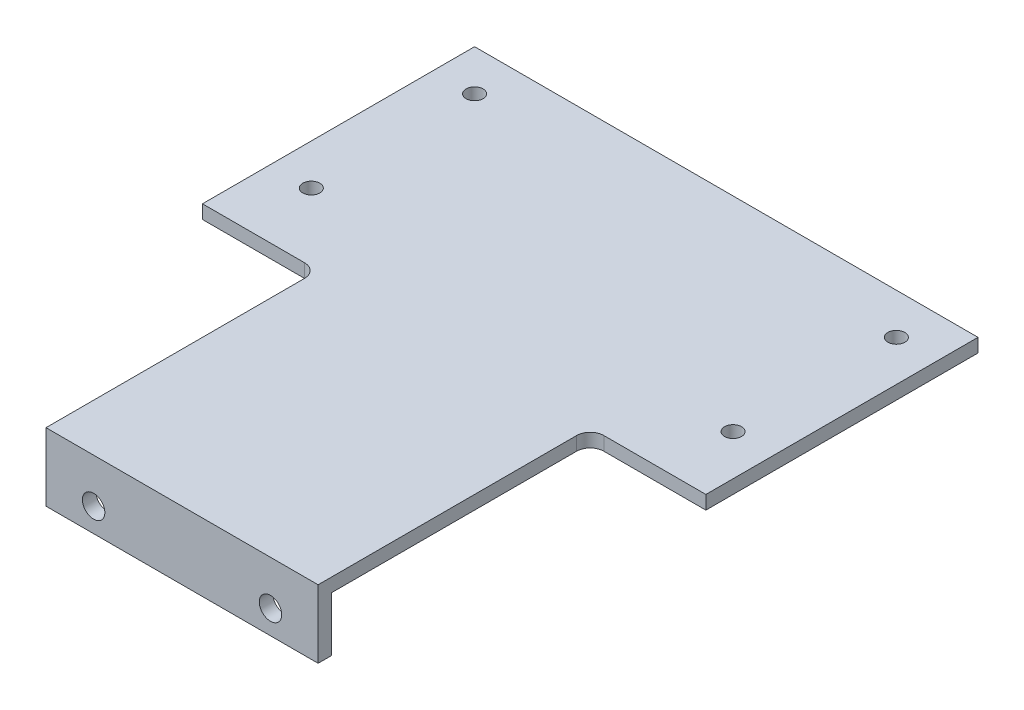
from build123d import *

# Parameters (mm, degrees)
EXTRUDE_1_DEPTH     = 2
SKETCH_2_W          = 40
SKETCH_2_H          = 2
EXTRUDE_2_DEPTH     = 8
SKETCH_3_R          = 1.65
CUT_EXTRUDE_1_DEPTH = 97.938124595
SKETCH_13_R         = 1.25
CUT_EXTRUDE_4_DEPTH = 99.737024464
FILLET_1_R          = 2
CUT_EXTRUDE_3_DEPTH = 108.925900506


with BuildPart() as part:
    # 草图1 → 凸台-拉伸1 (new body)
    with BuildSketch(Plane(origin=(0, 0, 0), x_dir=(1, 0, 0), z_dir=(0, 1, 0))):
        Polygon((0, 0), (40, 0), (40, 40), (57, 40), (57, 80), (-17, 80), (-17, 40), (0, 40), align=None)
    extrude(amount=EXTRUDE_1_DEPTH)

    # 草图2 → 凸台-拉伸2 (add)
    with BuildSketch(Plane(origin=(0, 0, 0), x_dir=(-1, 0, 0), z_dir=(0, -1, 0))):
        with Locations((-20, 1)):
            Rectangle(SKETCH_2_W, SKETCH_2_H)
    extrude(amount=EXTRUDE_2_DEPTH)

    # 草图3 → 切除-拉伸1 (cut, through all)
    with BuildSketch(Plane(origin=(0, 0, -2), x_dir=(-1, 0, 0), z_dir=(0, 0, -1))):
        with Locations((-33, -4.5)):
            Circle(SKETCH_3_R)
        with Locations((-7, -4.5)):
            Circle(SKETCH_3_R)
    extrude(amount=-CUT_EXTRUDE_1_DEPTH, mode=Mode.SUBTRACT)

    # 草图13 → 切除-拉伸4 (cut, through all)
    with BuildSketch(Plane(origin=(0, 2, 0), x_dir=(1, 0, 0), z_dir=(0, 1, 0))):
        with Locations((-11, 74)):
            Circle(SKETCH_13_R)
        with Locations((-11, 50)):
            Circle(SKETCH_13_R)
        with Locations((51, 50)):
            Circle(SKETCH_13_R)
        with Locations((51, 74)):
            Circle(SKETCH_13_R)
    extrude(amount=-CUT_EXTRUDE_4_DEPTH, mode=Mode.SUBTRACT)

    # 圆角1
    fillet_1_edges = [part.edges().sort_by_distance(p)[0] for p in [
        (0, 1, -40),
        (40, 1, -40),
    ]]
    fillet(fillet_1_edges, radius=FILLET_1_R)

    # 草图12 → 切除-拉伸3 (cut, through all)
    with BuildSketch(Plane(origin=(-15, 0, 0), x_dir=(0, 0, -1), z_dir=(1, 0, 0))):
        with BuildLine():
            ThreePointArc((72.447274003, -19.777424568), (53.780031477, -15.211375276), (43.811964782, -31.641603394))
            ThreePointArc((43.811964782, -31.641603394), (46.249688925, -33.686719774), (48.294805304, -31.248995631))
            ThreePointArc((48.294805304, -31.248995631), (55.502484299, -19.368676838), (69.000336587, -22.670281711))
            ThreePointArc((69.000336587, -22.670281711), (72.170233866, -22.947321847), (72.447274003, -19.777424568))
        make_face()
    cut_extrude_3 = extrude(amount=-CUT_EXTRUDE_3_DEPTH, mode=Mode.SUBTRACT)

    # 镜向3: 切除-拉伸3 across plane
    add(cut_extrude_3.mirror(Plane(origin=(20, 0, 0), x_dir=(0, 0, 1), z_dir=(1, 0, 0))), mode=Mode.SUBTRACT)


solid = part.part
